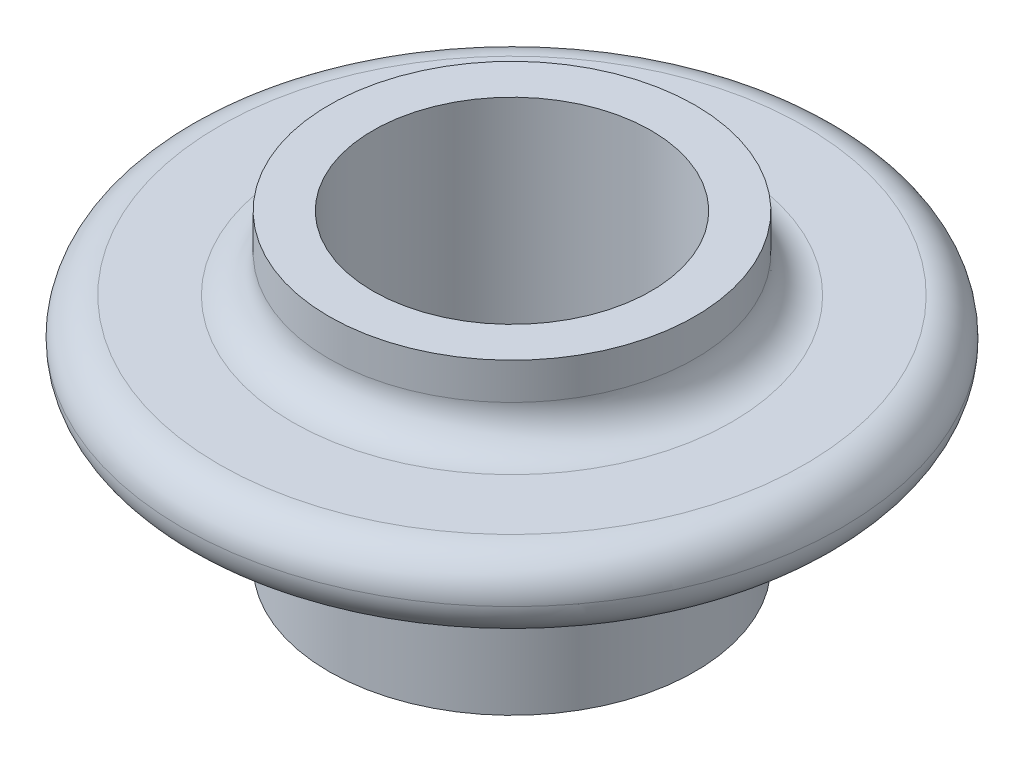
from build123d import *

# Parameters (mm, degrees)
FILLET1_R = 5


with BuildPart() as part:
    # Sketch1 → Revolve1 (revolve)
    with BuildSketch(Plane.XY, mode=Mode.PRIVATE) as revolve1_sk:
        Polygon((19, 0), (19, 42), (25, 42), (25, 32), (45, 32), (45, 22), (25, 22), (25, 0), align=None)
    revolve(revolve1_sk.sketch.rotate(Axis((0, 0, 0), (0, 1, 0)), 90), axis=Axis((0, 0, 0), (0, 1, 0)))

    # Fillet1
    fillet1_edges = [part.edges().sort_by_distance(p)[0] for p in [
        (0, 22, 45),
        (0, 32, 45),
        (0, 32, 25),
    ]]
    fillet(fillet1_edges, radius=FILLET1_R - 0.0001)  # a hair under: the kernel refuses the full size


solid = part.part
